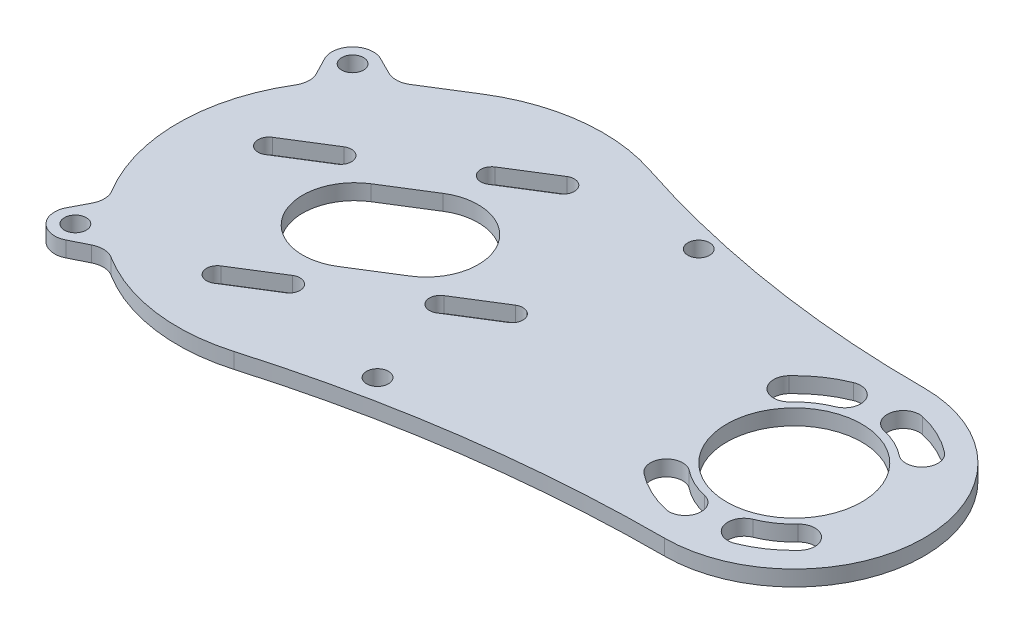
from build123d import *

# Parameters (mm, degrees)
SKETCH_2_R               = 13
EXTRUDE_1_DEPTH          = 3
CUT_EXTRUDE_2_DEPTH      = 110.084751045
PATTERN_CURVE_1_DEPTH    = 3
CUT_EXTRUDE_4_DEPTH      = 110.084751045
PATTERN_CIRCULAR_1_COUNT = 6
EXTRUDE_2_DEPTH          = 3
HOLE_WIZARD_M4_1_D       = 4.2
FILLET_1_R               = 4
SKETCH1_R                = 2.1
CUT_EXTRUDE1_DEPTH       = 110.084751045


# Read off the part's stored shape, not the designer's step: 곡선 패턴1
with BuildPart() as part:
    # 스케치2 → 보스-돌출1 (new body)
    with BuildSketch(Plane(origin=(0, 0, 0), x_dir=(1, 0, 0), z_dir=(0, 1, 0))):
        with BuildLine():
            ThreePointArc((77.639466647, 24.999926714), (45.838842968, 27.466341176), (14.834721753, 34.956824097))
            ThreePointArc((14.834721753, 34.956824097), (0.14257607, 36.40176879), (-13.777014503, 31.48323159))
            Line((-13.777014503, 31.48323159), (-22.257495465, 26.184038948))
            ThreePointArc((-22.257495465, 26.184038948), (-35.278632699, -16.528292532), (5.235906124, -35.302354942))
            ThreePointArc((5.235906124, -35.302354942), (41.103608721, -27.588473828), (77.7, -25))
            ThreePointArc((77.7, -25), (102.699981679, 0.030266699), (77.639466647, 24.999926714))
        make_face()
        with BuildLine():
            Line((-9.539433123, 5.83088464), (-1.058952162, 11.130077283))
            ThreePointArc((-1.058952162, 11.130077283), (12.720721442, 7.948788963), (9.539433123, -5.83088464))
            Line((9.539433123, -5.83088464), (1.058952162, -11.130077283))
            ThreePointArc((1.058952162, -11.130077283), (-12.720721442, -7.948788963), (-9.539433123, 5.83088464))
        make_face(mode=Mode.SUBTRACT)
        with Locations(Location((77.7, 0, 0), (0, 0, 270))):
            Circle(SKETCH_2_R, mode=Mode.SUBTRACT)
    extrude(amount=EXTRUDE_1_DEPTH)

    # 스케치4 → 컷-돌출2 (cut, through all)
    with BuildSketch(Plane(origin=(0, 0, 0), x_dir=(-1, 0, 0), z_dir=(0, -1, 0))):
        with BuildLine():
            Line((1.82151317, -17.005644102), (10.301994131, -22.304836745))
            ThreePointArc((10.301994131, -22.304836745), (10.970064678, -25.198568201), (8.076333221, -25.866638748))
            Line((8.076333221, -25.866638748), (-0.40414774, -20.567446106))
            ThreePointArc((-0.40414774, -20.567446106), (-1.072218287, -17.673714649), (1.82151317, -17.005644102))
        make_face()
    extrude(amount=-CUT_EXTRUDE_2_DEPTH, mode=Mode.SUBTRACT)

    # 곡선 패턴1 outline → 곡선 패턴1 (cut)
    with BuildSketch(Plane(origin=(0, 0, 0), x_dir=(1, 0, 0), z_dir=(0, 1, 0))):
        with BuildLine():
            Line((24.563551451, -0.518425872), (16.08307049, -5.817618515))
            ThreePointArc((16.08307049, -5.817618515), (15.414999943, -8.711349971), (18.308731399, -9.379420519))
            Line((18.308731399, -9.379420519), (26.789212361, -4.080227876))
            ThreePointArc((26.789212361, -4.080227876), (27.457282908, -1.186496419), (24.563551451, -0.518425872))
        make_face()
        with BuildLine():
            ThreePointArc((-16.08307049, 5.817618515), (-15.414999943, 8.711349971), (-18.308731399, 9.379420519))
            Line((-18.308731399, 9.379420519), (-26.789212361, 4.080227876))
            ThreePointArc((-26.789212361, 4.080227876), (-27.457282908, 1.186496419), (-24.563551451, 0.518425872))
            Line((-24.563551451, 0.518425872), (-16.08307049, 5.817618515))
        make_face()
        with BuildLine():
            Line((8.076333221, 25.866638748), (-0.40414774, 20.567446106))
            ThreePointArc((-0.40414774, 20.567446106), (-1.072218287, 17.673714649), (1.82151317, 17.005644102))
            Line((1.82151317, 17.005644102), (10.301994131, 22.304836745))
            ThreePointArc((10.301994131, 22.304836745), (10.970064678, 25.198568202), (8.076333221, 25.866638748))
        make_face()
    extrude(amount=PATTERN_CURVE_1_DEPTH, mode=Mode.SUBTRACT)

    # 스케치5 → 컷-돌출4 (cut, through all)
    with BuildSketch(Plane(origin=(0, 0, 0), x_dir=(-1, 0, 0), z_dir=(0, -1, 0))):
        with BuildLine():
            ThreePointArc((-73.066008281, -20.072023335), (-68.831471406, -18.593256858), (-65.017373608, -16.233021524))
            ThreePointArc((-65.017373608, -16.233021524), (-64.483090846, -11.881637615), (-68.834474755, -11.347354852))
            ThreePointArc((-68.834474755, -11.347354852), (-71.500640206, -12.997228095), (-74.460704817, -14.030928933))
            ThreePointArc((-74.460704817, -14.030928933), (-76.78390375, -17.748824402), (-73.066008281, -20.072023335))
        make_face()
    cut_extrude_4 = extrude(amount=-CUT_EXTRUDE_4_DEPTH, mode=Mode.SUBTRACT)

    # 원형 패턴1: 컷-돌출4 ×6 about axis, 2 skipped
    pattern_circular_1_axis = Axis((77.7, 3, 0), (0, -1, 0))
    add([cut_extrude_4.rotate(pattern_circular_1_axis, i * 360 / PATTERN_CIRCULAR_1_COUNT) for i in range(1, PATTERN_CIRCULAR_1_COUNT) if i not in (1, 4)], mode=Mode.SUBTRACT)

    # 스케치7 → 보스-돌출2 (add)
    with BuildSketch(Plane.XZ):
        with BuildLine():
            ThreePointArc((-34.857379721, -22.180465117), (-34.155886305, -26.830127811), (-29.517020915, -27.599792717))
            Line((-29.517020915, -27.599792717), (-24.147285754, -24.913232788))
            ThreePointArc((-24.147285754, -24.913232788), (-28.457668053, -21.214942262), (-32.092293027, -16.850741341))
            Line((-32.092293027, -16.850741341), (-34.857379721, -22.180465117))
        make_face()
        with BuildLine():
            ThreePointArc((-29.517020915, 32.898985359), (-34.155886305, 32.129320453), (-34.857379721, 27.479657759))
            Line((-34.857379721, 27.479657759), (-32.092293027, 22.149933984))
            ThreePointArc((-32.092293027, 22.149933984), (-28.457668053, 26.514134904), (-24.147285754, 30.21242543))
            Line((-24.147285754, 30.21242543), (-29.517020915, 32.898985359))
        make_face()
    extrude(amount=-EXTRUDE_2_DEPTH)

    # M4 나선 코일용 탭 드릴1 (through all)
    with Locations(Plane(origin=(0, 3, 0), x_dir=(1, 0, 0), z_dir=(0, 1, 0))):
        with Locations((-31.306777179, 24.022535036), (-31.306777179, -29.321727679)):
            Hole(HOLE_WIZARD_M4_1_D / 2)

    # 필렛1
    fillet_1_edges = [part.edges().sort_by_distance(p)[0] for p in [
        (-24.147285754, 1.5, -24.913232788),
        (-32.092293027, 1.5, -16.850741341),
        (-32.092293027, 1.5, 22.149933984),
        (-24.147285754, 1.5, 30.21242543),
    ]]
    fillet(fillet_1_edges, radius=FILLET_1_R)

    # Sketch1 → Cut-Extrude1 (cut, through all)
    with BuildSketch(Plane(origin=(0, 3, 0), x_dir=(1, 0, 0), z_dir=(0, 1, 0))):
        with Locations(Location((32.847987975, 26.475635233, 0), (0, 0, 270))):
            Circle(SKETCH1_R)
        with Locations(Location((23.37032867, -25.857527018, 0), (0, 0, 270))):
            Circle(SKETCH1_R)
    extrude(amount=-CUT_EXTRUDE1_DEPTH, mode=Mode.SUBTRACT)


solid = part.part
